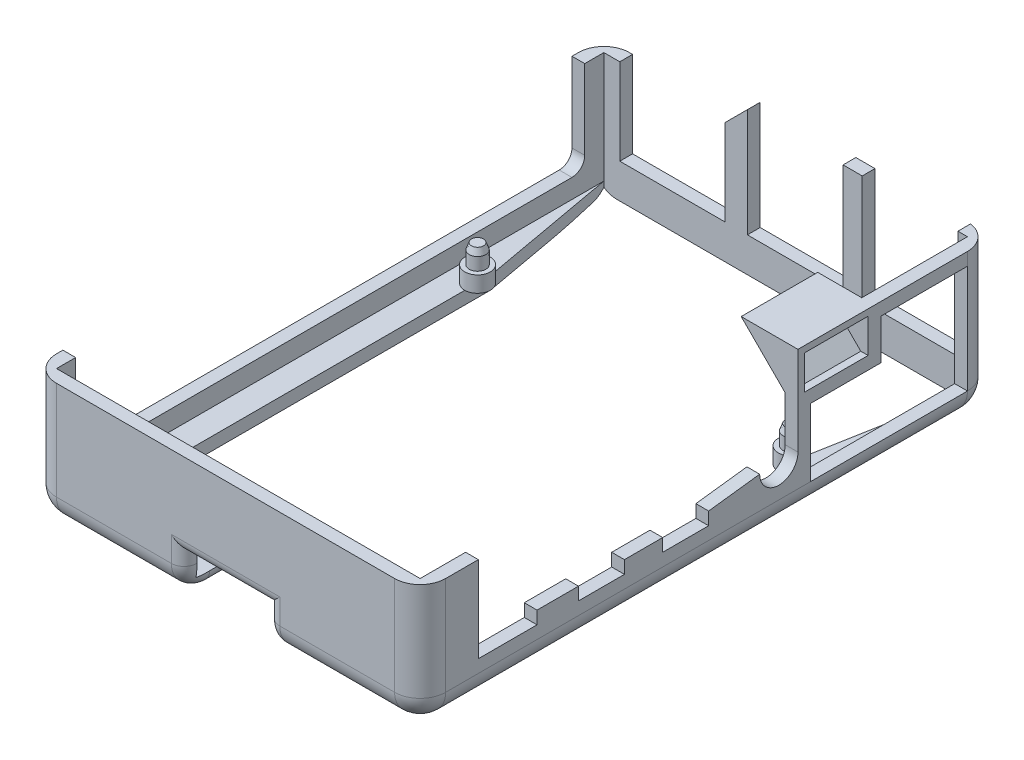
from build123d import *

# Parameters (mm, degrees)
SZKIC1_W                     = 56.2
SZKIC1_H                     = 85
DODANIE_WYCI_GNI_CIE2_DEPTH  = 2
SZKIC2_R                     = 2
DODANIE_WYCI_GNI_CIE5_DEPTH  = 2.5
SZKIC4_R                     = 1.3
DODANIE_WYCI_GNI_CIE6_DEPTH  = 2
SZKIC6_R                     = 1.3
DODANIE_WYCI_GNI_CIE7_DEPTH  = 1
DODANIE_WYCI_GNI_CIE7_TAPER  = 20
SZKIC1_4_W                   = 57
SZKIC1_4_H                   = 85.8
SZKIC1_4_W_2                 = 56.2
SZKIC1_4_H_2                 = 85
DODANIE_WYCI_GNI_CIE3_DEPTH  = 2
SZKIC1_5_W                   = 61
SZKIC1_5_H                   = 89.8
SZKIC1_5_W_2                 = 57
SZKIC1_5_H_2                 = 85.8
DODANIE_WYCI_GNI_CIE4_DEPTH  = 4.5
LUSTRO2_COPY_1_SKETCH_R      = 1.3
LUSTRO2_COPY_1_DEPTH         = 2
LUSTRO2_COPY_2_SKETCH_R      = 1.3
LUSTRO2_COPY_2_DEPTH         = 1
LUSTRO2_COPY_2_TAPER         = 20
SZKIC12_W                    = 13
SZKIC12_H                    = 4.5
WYTNIJ_WYCI_GNI_CIE4_DEPTH   = 10
DODANIE_WYCI_GNI_CIE8_DEPTH  = 1.45
SZKIC14_W                    = 61
SZKIC14_H                    = 89.8
SZKIC14_W_2                  = 57
SZKIC14_H_2                  = 85.8
DODANIE_WYCI_GNI_CIE9_DEPTH  = 17
SZKIC15_W                    = 16.5
SZKIC15_H                    = 17
SZKIC15_W_2                  = 15
WYTNIJ_WYCI_GNI_CIE5_DEPTH   = 2
SZKIC16_W                    = 9.2
SZKIC16_H                    = 10.95
SZKIC16_H_2                  = 2
SZKIC16_W_2                  = 7.2
SZKIC16_W_3                  = 8
SZKIC16_W_4                  = 6
SZKIC16_W_5                  = 6.5
WYTNIJ_WYCI_GNI_CIE6_DEPTH   = 2
ZAOKR_GLENIE1_R              = 4
ZAOKR_GLENIE2_R              = 2
DODANIE_WYCI_GNI_CIE10_DEPTH = 12
WYTNIJ_WYCI_GNI_CIE8_REACH   = 81.144
SZKIC19_W                    = 10
SZKIC19_H                    = 5.333929422
DODANIE_WYCI_GNI_CIE11_DEPTH = 10
WYTNIJ_WYCI_GNI_CIE9_REACH   = 60.932
WYTNIJ_WYCI_GNI_CIE10_DEPTH  = 2
SZKIC23_W                    = 87.8
SZKIC23_H                    = 3.5
WYTNIJ_WYCI_GNI_CIE11_DEPTH  = 2
SZKIC24_W                    = 59
SZKIC24_H                    = 3.5
WYTNIJ_WYCI_GNI_CIE12_DEPTH  = 2
SZKIC25_W                    = 7.125
SZKIC25_H                    = 3.5
WYTNIJ_WYCI_GNI_CIE13_DEPTH  = 2
WYTNIJ_WYCI_GNI_CIE14_DEPTH  = 2
WYTNIJ_WYCI_GNI_CIE16_DEPTH  = 2


with BuildPart() as part:
    # Szkic1 → Dodanie-wyciągnięcie2 (new body)
    with BuildSketch(Plane(origin=(0, 0, 0), x_dir=(1, 0, 0), z_dir=(0, 1, 0))):
        Rectangle(SZKIC1_W, SZKIC1_H)
    extrude(amount=DODANIE_WYCI_GNI_CIE2_DEPTH)

    # Szkic2 → Dodanie-wyciągnięcie5 (add)
    with BuildSketch(Plane(origin=(0, 2, 0), x_dir=(1, 0, 0), z_dir=(0, 1, 0))):
        with Locations(Location((-24.575, -38.975, 0), (0, 0, 270))):
            Circle(SZKIC2_R)
        with Locations(Location((24.575, -38.975, 0), (0, 0, 270))):
            Circle(SZKIC2_R)
        with Locations(Location((-24.575, 19.175, 0), (0, 0, 270))):
            Circle(SZKIC2_R)
        with Locations(Location((24.575, 19.175, 0), (0, 0, 270))):
            Circle(SZKIC2_R)
    extrude(amount=DODANIE_WYCI_GNI_CIE5_DEPTH)

    # Szkic4 → Dodanie-wyciągnięcie6 (add)
    with BuildSketch(Plane(origin=(0, 4.5, 0), x_dir=(1, 0, 0), z_dir=(0, 1, 0))):
        with Locations(Location((-24.575, 19.175, 0), (0, 0, 270))):
            Circle(SZKIC4_R)
    dodanie_wyci_gni_cie6 = extrude(amount=DODANIE_WYCI_GNI_CIE6_DEPTH)

    # Szkic6 → Dodanie-wyciągnięcie7 (add)
    with BuildSketch(Plane(origin=(0, 6.5, 0), x_dir=(1, 0, 0), z_dir=(0, 1, 0))):
        with Locations(Location((-24.575, 19.175, 0), (0, 0, 270))):
            Circle(SZKIC6_R)
    dodanie_wyci_gni_cie7 = extrude(amount=DODANIE_WYCI_GNI_CIE7_DEPTH, taper=DODANIE_WYCI_GNI_CIE7_TAPER)

    # Szkic1<4> → Dodanie-wyciągnięcie3 (add)
    with BuildSketch(Plane(origin=(0, 0, 0), x_dir=(1, 0, 0), z_dir=(0, 1, 0))):
        Rectangle(SZKIC1_4_W, SZKIC1_4_H)
        Rectangle(SZKIC1_4_W_2, SZKIC1_4_H_2, mode=Mode.SUBTRACT)
    extrude(amount=DODANIE_WYCI_GNI_CIE3_DEPTH)

    # Szkic1<5> → Dodanie-wyciągnięcie4 (add)
    with BuildSketch(Plane(origin=(0, 0, 0), x_dir=(1, 0, 0), z_dir=(0, 1, 0))):
        Rectangle(SZKIC1_5_W, SZKIC1_5_H)
        Rectangle(SZKIC1_5_W_2, SZKIC1_5_H_2, mode=Mode.SUBTRACT)
    extrude(amount=DODANIE_WYCI_GNI_CIE4_DEPTH)

    # Lustro1: Dodanie-wyciągnięcie6, Dodanie-wyciągnięcie7 across plane
    add(dodanie_wyci_gni_cie6.mirror(Plane(origin=(0, 0, 0), x_dir=(0, 0, 1), z_dir=(1, 0, 0))))
    add(dodanie_wyci_gni_cie7.mirror(Plane(origin=(0, 0, 0), x_dir=(0, 0, 1), z_dir=(1, 0, 0))))

    # Lustro2: Dodanie-wyciągnięcie6, Dodanie-wyciągnięcie7 across plane
    add(dodanie_wyci_gni_cie6.mirror(Plane.XY.offset(9.9)))
    add(dodanie_wyci_gni_cie7.mirror(Plane.XY.offset(9.9)))

    # Lustro2 copy 1 sketch → Lustro2 copy 1 (add)
    with BuildSketch(Plane(origin=(0, 4.5, 19.8), x_dir=(-1, 0, 0), z_dir=(0, 1, 0))):
        with Locations(Location((-24.575, 19.175, 0), (0, 0, 270))):
            Circle(LUSTRO2_COPY_1_SKETCH_R)
    extrude(amount=LUSTRO2_COPY_1_DEPTH)

    # Lustro2 copy 2 sketch → Lustro2 copy 2 (add)
    with BuildSketch(Plane(origin=(0, 6.5, 19.8), x_dir=(-1, 0, 0), z_dir=(0, 1, 0))):
        with Locations(Location((-24.575, 19.175, 0), (0, 0, 270))):
            Circle(LUSTRO2_COPY_2_SKETCH_R)
    extrude(amount=LUSTRO2_COPY_2_DEPTH, taper=LUSTRO2_COPY_2_TAPER)

    # Szkic12 → Wytnij-wyciągnięcie4 (cut)
    with BuildSketch(Plane.XY.offset(44.9)):
        with Locations((0, 2.25)):
            Rectangle(SZKIC12_W, SZKIC12_H)
    extrude(amount=-WYTNIJ_WYCI_GNI_CIE4_DEPTH, mode=Mode.SUBTRACT)

    # Szkic13 → Dodanie-wyciągnięcie8 (add)
    with BuildSketch(Plane(origin=(0, 4.5, 0), x_dir=(1, 0, 0), z_dir=(0, 1, 0))):
        Polygon((-6.5, -44.9), (-6.5, -42.9), (-28.5, -42.9), (-28.5, 42.9), (28.5, 42.9), (28.5, -42.9), (6.5, -42.9), (6.5, -44.9), (30.5, -44.9), (30.5, 44.9), (-30.5, 44.9), (-30.5, -44.9), align=None)
    extrude(amount=DODANIE_WYCI_GNI_CIE8_DEPTH)

    # Szkic14 → Dodanie-wyciągnięcie9 (add)
    with BuildSketch(Plane(origin=(0, 5.95, 0), x_dir=(1, 0, 0), z_dir=(0, 1, 0))):
        Rectangle(SZKIC14_W, SZKIC14_H)
        Rectangle(SZKIC14_W_2, SZKIC14_H_2, mode=Mode.SUBTRACT)
    extrude(amount=DODANIE_WYCI_GNI_CIE9_DEPTH)

    # Szkic15 → Wytnij-wyciągnięcie5 (cut)
    with BuildSketch(Plane(origin=(0, 0, -44.9), x_dir=(-1, 0, 0), z_dir=(0, 0, -1))):
        with Locations((17.75, 14.45)):
            Rectangle(SZKIC15_W, SZKIC15_H)
        with Locations((-1.5, 14.45)):
            Rectangle(SZKIC15_W_2, SZKIC15_H)
        with Locations((-19.5, 14.45)):
            Rectangle(SZKIC15_W_2, SZKIC15_H)
    extrude(amount=-WYTNIJ_WYCI_GNI_CIE5_DEPTH, mode=Mode.SUBTRACT)

    # Szkic16 → Wytnij-wyciągnięcie6 (cut)
    with BuildSketch(Plane(origin=(30.5, 0, 0), x_dir=(0, 0, -1), z_dir=(1, 0, 0))):
        with Locations((-31.175, 17.475)):
            Rectangle(SZKIC16_W, SZKIC16_H)
        with Locations((-31.175, 11)):
            Rectangle(SZKIC16_W, SZKIC16_H_2)
        with Locations((-31.175, 9)):
            Rectangle(SZKIC16_W, SZKIC16_H_2)
        with Locations((-31.175, 7)):
            Rectangle(SZKIC16_W, SZKIC16_H_2)
        with Locations((-16.475, 17.475)):
            Rectangle(SZKIC16_W_2, SZKIC16_H)
        with Locations((-16.475, 11)):
            Rectangle(SZKIC16_W_2, SZKIC16_H_2)
        with Locations((-16.475, 9)):
            Rectangle(SZKIC16_W_2, SZKIC16_H_2)
        with Locations((-16.475, 7)):
            Rectangle(SZKIC16_W_2, SZKIC16_H_2)
        with Locations((-3.275, 17.475)):
            Rectangle(SZKIC16_W_2, SZKIC16_H)
        with Locations((-3.275, 11)):
            Rectangle(SZKIC16_W_2, SZKIC16_H_2)
        with Locations((-3.275, 9)):
            Rectangle(SZKIC16_W_2, SZKIC16_H_2)
        with Locations((-3.275, 7)):
            Rectangle(SZKIC16_W_2, SZKIC16_H_2)
        with Locations((4.325, 17.475)):
            Rectangle(SZKIC16_W_3, SZKIC16_H)
        with Locations((4.325, 11)):
            Rectangle(SZKIC16_W_3, SZKIC16_H_2)
        Polygon((8.325, 10), (0.325, 10), (0.325, 8), (8.325, 9), align=None)
        with Locations((-9.875, 17.475)):
            Rectangle(SZKIC16_W_4, SZKIC16_H)
        with Locations((-9.875, 11)):
            Rectangle(SZKIC16_W_4, SZKIC16_H_2)
        with Locations((-9.875, 9)):
            Rectangle(SZKIC16_W_4, SZKIC16_H_2)
        with Locations((-23.325, 17.475)):
            Rectangle(SZKIC16_W_5, SZKIC16_H)
        with Locations((-23.325, 11)):
            Rectangle(SZKIC16_W_5, SZKIC16_H_2)
        with Locations((-23.325, 9)):
            Rectangle(SZKIC16_W_5, SZKIC16_H_2)
        with BuildLine():
            ThreePointArc((8.496572875, 10), (8.368204321, 9.507305936), (8.325, 9))
            ThreePointArc((8.325, 9), (8.368204321, 8.492694064), (8.496572875, 8))
            Line((8.496572875, 8), (14.153427125, 8))
            ThreePointArc((14.153427125, 8), (14.281795679, 8.492694064), (14.325, 9))
            ThreePointArc((14.325, 9), (14.281795679, 9.507305936), (14.153427125, 10))
            Line((14.153427125, 10), (8.496572875, 10))
        make_face()
        with BuildLine():
            ThreePointArc((14.153427125, 10), (13.057050808, 11.449489743), (11.325, 12))
            ThreePointArc((11.325, 12), (9.592949192, 11.449489743), (8.496572875, 10))
            Line((8.496572875, 10), (14.153427125, 10))
        make_face()
        with BuildLine():
            Line((14.153427125, 8), (8.496572875, 8))
            ThreePointArc((8.496572875, 8), (9.592949189, 6.55051026), (11.324999991, 6))
            ThreePointArc((11.324999991, 6), (13.057050804, 6.550510255), (14.153427125, 8))
        make_face()
        with BuildLine():
            Line((11.325, 12), (8.325, 12))
            Line((8.325, 12), (8.325, 10))
            Line((8.325, 10), (8.496572875, 10))
            ThreePointArc((8.496572875, 10), (9.592949192, 11.449489743), (11.325, 12))
        make_face()
        with BuildLine():
            Line((14.325, 10), (14.325, 12))
            Line((14.325, 12), (11.325, 12))
            ThreePointArc((11.325, 12), (13.057050808, 11.449489743), (14.153427125, 10))
            Line((14.153427125, 10), (14.325, 10))
        make_face()
        Polygon((14.325, 22.95), (8.325, 22.95), (8.325, 12), (11.325, 12), (14.325, 12), align=None)
        with BuildLine():
            Line((14.325, 9), (14.325, 10))
            Line((14.325, 10), (14.153427125, 10))
            ThreePointArc((14.153427125, 10), (14.281795679, 9.507305936), (14.325, 9))
        make_face()
        with BuildLine():
            Line((8.496572875, 10), (8.325, 10))
            Line((8.325, 10), (8.325, 9))
            ThreePointArc((8.325, 9), (8.368204321, 9.507305936), (8.496572875, 10))
        make_face()
    extrude(amount=-WYTNIJ_WYCI_GNI_CIE6_DEPTH, mode=Mode.SUBTRACT)

    # Zaokrąglenie1
    zaokr_glenie1_edges = [part.edges().sort_by_distance(p)[0] for p in [
        (-18.5, 0, 44.9),
        (18.5, 0, 44.9),
        (30.5, 0, 0),
        (-30.5, 0, 0),
        (0, 0, -44.9),
        (-30.5, 11.475, -44.9),
        (30.5, 11.475, -44.9),
        (30.5, 11.475, 44.9),
        (-30.5, 11.475, 44.9),
    ]]
    fillet(zaokr_glenie1_edges, radius=ZAOKR_GLENIE1_R)

    # Zaokrąglenie2
    # the kernel refuses this fillet: 2 mm, written as the material it takes off along each edge
    with BuildSketch(Plane(origin=(6.5, 5.95, 44.9), x_dir=(0, 0, -1), z_dir=(0, -1, 0))) as zaokr_glenie2_piece_1:
        with BuildLine():
            CenterArc((ZAOKR_GLENIE2_R, ZAOKR_GLENIE2_R), ZAOKR_GLENIE2_R, 180, 90)
            Line((0, ZAOKR_GLENIE2_R), (0, 0))
            Line((0, 0), (ZAOKR_GLENIE2_R, 0))
        make_face()
    extrude(amount=1.95, mode=Mode.SUBTRACT)
    with BuildSketch(Plane(origin=(-6.5, 5.95, 44.9), x_dir=(0, 0, -1), z_dir=(0, -1, 0))) as zaokr_glenie2_piece_2:
        with BuildLine():
            CenterArc((ZAOKR_GLENIE2_R, -ZAOKR_GLENIE2_R), ZAOKR_GLENIE2_R, 90, 90)
            Line((0, -ZAOKR_GLENIE2_R), (0, 0))
            Line((0, 0), (ZAOKR_GLENIE2_R, 0))
        make_face()
    extrude(amount=1.95, mode=Mode.SUBTRACT)
    with BuildSketch(Plane(origin=(-6.5, 0, 40.9), x_dir=(-1, 0, 0), z_dir=(0, 0, -1))) as zaokr_glenie2_piece_3:
        with BuildLine():
            CenterArc((ZAOKR_GLENIE2_R, ZAOKR_GLENIE2_R), ZAOKR_GLENIE2_R, 180, 90)
            Line((0, ZAOKR_GLENIE2_R), (0, 0))
            Line((0, 0), (ZAOKR_GLENIE2_R, 0))
        make_face()
    extrude(amount=6, mode=Mode.SUBTRACT)
    with BuildSketch(Plane(origin=(-6.5, 5.95, 44.9), x_dir=(0, 1, 0), z_dir=(1, 0, 0))) as zaokr_glenie2_piece_4:
        with BuildLine():
            CenterArc((ZAOKR_GLENIE2_R, -ZAOKR_GLENIE2_R), ZAOKR_GLENIE2_R, 90, 90)
            Line((0, -ZAOKR_GLENIE2_R), (0, 0))
            Line((0, 0), (ZAOKR_GLENIE2_R, 0))
        make_face()
    extrude(amount=13, mode=Mode.SUBTRACT)
    with BuildSketch(Plane(origin=(6.5, 0, 40.9), x_dir=(1, 0, 0), z_dir=(0, 0, -1))) as zaokr_glenie2_piece_5:
        with BuildLine():
            CenterArc((ZAOKR_GLENIE2_R, -ZAOKR_GLENIE2_R), ZAOKR_GLENIE2_R, 90, 90)
            Line((0, -ZAOKR_GLENIE2_R), (0, 0))
            Line((0, 0), (ZAOKR_GLENIE2_R, 0))
        make_face()
    extrude(amount=6, mode=Mode.SUBTRACT)
    with BuildSketch(Plane(origin=(6.5, 4, 40.9), x_dir=(0, -1, 0), z_dir=(0, 0, -1))) as zaokr_glenie2_piece_6:
        with BuildLine():
            CenterArc((4 - ZAOKR_GLENIE2_R, -ZAOKR_GLENIE2_R), ZAOKR_GLENIE2_R, 0, 90)
            Line((4, -ZAOKR_GLENIE2_R), (4, 0))
            Line((4, 0), (4 - ZAOKR_GLENIE2_R, 0))
        make_face()
    revolve(axis=Axis((6.5, 4, 40.9), (-1, 0, 0)), revolution_arc=90, mode=Mode.SUBTRACT)
    with BuildSketch(Plane(origin=(-6.5, 4, 40.9), x_dir=(0, -1, 0), z_dir=(0, 0, -1))) as zaokr_glenie2_piece_7:
        with BuildLine():
            CenterArc((4 - ZAOKR_GLENIE2_R, ZAOKR_GLENIE2_R), ZAOKR_GLENIE2_R, 270, 90)
            Line((4, ZAOKR_GLENIE2_R), (4, 0))
            Line((4, 0), (4 - ZAOKR_GLENIE2_R, 0))
        make_face()
    revolve(axis=Axis((-6.5, 4, 40.9), (-1, 0, 0)), revolution_arc=90, mode=Mode.SUBTRACT)
    with BuildSketch(Plane(origin=(-6.5, 0, 34.9), x_dir=(0, 0, -1), z_dir=(1, 0, 0))) as zaokr_glenie2_piece_8:
        with BuildLine():
            CenterArc((ZAOKR_GLENIE2_R, ZAOKR_GLENIE2_R), ZAOKR_GLENIE2_R, 180, 90)
            Line((0, ZAOKR_GLENIE2_R), (0, 0))
            Line((0, 0), (ZAOKR_GLENIE2_R, 0))
        make_face()
    extrude(amount=13, mode=Mode.SUBTRACT)
    with BuildSketch(Plane(origin=(6.5, 10.95, 44.9), x_dir=(0, 0, -1), z_dir=(0, -1, 0))) as zaokr_glenie2_piece_9a_section:
        with BuildLine():
            CenterArc((ZAOKR_GLENIE2_R, ZAOKR_GLENIE2_R), ZAOKR_GLENIE2_R, 180, 90)
            Line((0, ZAOKR_GLENIE2_R), (0, 0))
            Line((0, 0), (ZAOKR_GLENIE2_R, 0))
        make_face()
    zaokr_glenie2_piece_9a = extrude(amount=6.95, mode=Mode.PRIVATE)
    zaokr_glenie2_piece_9a = split(zaokr_glenie2_piece_9a, bisect_by=Plane(origin=(6.952790229, 5.95, 44.447209771), z_dir=(0, 1, 0)), keep=Keep.TOP, mode=Mode.PRIVATE)
    with BuildSketch(Plane(origin=(-6.5, 5.95, 44.9), x_dir=(0, 1, 0), z_dir=(1, 0, 0))) as zaokr_glenie2_piece_9b_section:
        with BuildLine():
            CenterArc((ZAOKR_GLENIE2_R, -ZAOKR_GLENIE2_R), ZAOKR_GLENIE2_R, 90, 90)
            Line((0, -ZAOKR_GLENIE2_R), (0, 0))
            Line((0, 0), (ZAOKR_GLENIE2_R, 0))
        make_face()
    zaokr_glenie2_piece_9b = extrude(amount=18, mode=Mode.PRIVATE)
    zaokr_glenie2_piece_9b = split(zaokr_glenie2_piece_9b, bisect_by=Plane(origin=(6.5, 6.402790229, 44.447209771), z_dir=(1, 0, 0)), keep=Keep.TOP, mode=Mode.PRIVATE)
    zaokr_glenie2_piece_9 = zaokr_glenie2_piece_9a & zaokr_glenie2_piece_9b
    add(zaokr_glenie2_piece_9, mode=Mode.SUBTRACT)
    with BuildSketch(Plane(origin=(-6.5, 10.95, 44.9), x_dir=(0, 0, -1), z_dir=(0, -1, 0))) as zaokr_glenie2_piece_10a_section:
        with BuildLine():
            CenterArc((ZAOKR_GLENIE2_R, -ZAOKR_GLENIE2_R), ZAOKR_GLENIE2_R, 90, 90)
            Line((0, -ZAOKR_GLENIE2_R), (0, 0))
            Line((0, 0), (ZAOKR_GLENIE2_R, 0))
        make_face()
    zaokr_glenie2_piece_10a = extrude(amount=6.95, mode=Mode.PRIVATE)
    zaokr_glenie2_piece_10a = split(zaokr_glenie2_piece_10a, bisect_by=Plane(origin=(-6.952790229, 5.95, 44.447209771), z_dir=(0, 1, 0)), keep=Keep.TOP, mode=Mode.PRIVATE)
    with BuildSketch(Plane(origin=(-11.5, 5.95, 44.9), x_dir=(0, 1, 0), z_dir=(1, 0, 0))) as zaokr_glenie2_piece_10b_section:
        with BuildLine():
            CenterArc((ZAOKR_GLENIE2_R, -ZAOKR_GLENIE2_R), ZAOKR_GLENIE2_R, 90, 90)
            Line((0, -ZAOKR_GLENIE2_R), (0, 0))
            Line((0, 0), (ZAOKR_GLENIE2_R, 0))
        make_face()
    zaokr_glenie2_piece_10b = extrude(amount=18, mode=Mode.PRIVATE)
    zaokr_glenie2_piece_10b = split(zaokr_glenie2_piece_10b, bisect_by=Plane(origin=(-6.5, 6.402790229, 44.447209771), z_dir=(-1, 0, 0)), keep=Keep.TOP, mode=Mode.PRIVATE)
    zaokr_glenie2_piece_10 = zaokr_glenie2_piece_10a & zaokr_glenie2_piece_10b
    add(zaokr_glenie2_piece_10, mode=Mode.SUBTRACT)
    with BuildSketch(Plane(origin=(-11.5, 0, 34.9), x_dir=(0, 0, -1), z_dir=(1, 0, 0))) as zaokr_glenie2_piece_11a_section:
        with BuildLine():
            CenterArc((ZAOKR_GLENIE2_R, ZAOKR_GLENIE2_R), ZAOKR_GLENIE2_R, 180, 90)
            Line((0, ZAOKR_GLENIE2_R), (0, 0))
            Line((0, 0), (ZAOKR_GLENIE2_R, 0))
        make_face()
    zaokr_glenie2_piece_11a = extrude(amount=18, mode=Mode.PRIVATE)
    zaokr_glenie2_piece_11a = split(zaokr_glenie2_piece_11a, bisect_by=Plane(origin=(-6.5, 0.452790229, 34.447209771), z_dir=(-1, 0, 0)), keep=Keep.TOP, mode=Mode.PRIVATE)
    with BuildSketch(Plane(origin=(-6.5, 0, 40.9), x_dir=(-1, 0, 0), z_dir=(0, 0, -1))) as zaokr_glenie2_piece_11b_section:
        with BuildLine():
            CenterArc((ZAOKR_GLENIE2_R, ZAOKR_GLENIE2_R), ZAOKR_GLENIE2_R, 180, 90)
            Line((0, ZAOKR_GLENIE2_R), (0, 0))
            Line((0, 0), (ZAOKR_GLENIE2_R, 0))
        make_face()
    zaokr_glenie2_piece_11b = extrude(amount=11, mode=Mode.PRIVATE)
    zaokr_glenie2_piece_11b = split(zaokr_glenie2_piece_11b, bisect_by=Plane(origin=(-6.952790229, 0.452790229, 34.9), z_dir=(0, 0, -1)), keep=Keep.TOP, mode=Mode.PRIVATE)
    zaokr_glenie2_piece_11 = zaokr_glenie2_piece_11a & zaokr_glenie2_piece_11b
    add(zaokr_glenie2_piece_11, mode=Mode.SUBTRACT)
    with BuildSketch(Plane(origin=(6.5, 0, 40.9), x_dir=(1, 0, 0), z_dir=(0, 0, -1))) as zaokr_glenie2_piece_12a_section:
        with BuildLine():
            CenterArc((ZAOKR_GLENIE2_R, -ZAOKR_GLENIE2_R), ZAOKR_GLENIE2_R, 90, 90)
            Line((0, -ZAOKR_GLENIE2_R), (0, 0))
            Line((0, 0), (ZAOKR_GLENIE2_R, 0))
        make_face()
    zaokr_glenie2_piece_12a = extrude(amount=11, mode=Mode.PRIVATE)
    zaokr_glenie2_piece_12a = split(zaokr_glenie2_piece_12a, bisect_by=Plane(origin=(6.952790229, 0.452790229, 34.9), z_dir=(0, 0, -1)), keep=Keep.TOP, mode=Mode.PRIVATE)
    with BuildSketch(Plane(origin=(-6.5, 0, 34.9), x_dir=(0, 0, -1), z_dir=(1, 0, 0))) as zaokr_glenie2_piece_12b_section:
        with BuildLine():
            CenterArc((ZAOKR_GLENIE2_R, ZAOKR_GLENIE2_R), ZAOKR_GLENIE2_R, 180, 90)
            Line((0, ZAOKR_GLENIE2_R), (0, 0))
            Line((0, 0), (ZAOKR_GLENIE2_R, 0))
        make_face()
    zaokr_glenie2_piece_12b = extrude(amount=18, mode=Mode.PRIVATE)
    zaokr_glenie2_piece_12b = split(zaokr_glenie2_piece_12b, bisect_by=Plane(origin=(6.5, 0.452790229, 34.447209771), z_dir=(1, 0, 0)), keep=Keep.TOP, mode=Mode.PRIVATE)
    zaokr_glenie2_piece_12 = zaokr_glenie2_piece_12a & zaokr_glenie2_piece_12b
    add(zaokr_glenie2_piece_12, mode=Mode.SUBTRACT)

    # Szkic18 → Dodanie-wyciągnięcie10 (add)
    with BuildSketch(Plane.XY.offset(-14.325)):
        Polygon((28.5, 22.95), (21.6, 22.95), (28.5, 16.05), align=None)
    extrude(amount=-DODANIE_WYCI_GNI_CIE10_DEPTH)

    # Wytnij-wyciągnięcie8: up to this plane
    wytnij_wyci_gni_cie8_end = Plane(origin=(21.6, 22.95, -26.325), z_dir=(-0.7071067811865515, -0.7071067811865436, 0))
    # Szkic19 → Wytnij-wyciągnięcie8 (cut, up to the surface)
    with BuildSketch(Plane(origin=(30.5, 0, 0), x_dir=(0, 0, -1), z_dir=(1, 0, 0)), mode=Mode.PRIVATE) as wytnij_wyci_gni_cie8_sk1:
        with Locations((20.325, 19.283035289)):
            Rectangle(SZKIC19_W, SZKIC19_H)
    wytnij_wyci_gni_cie8_tool1 = split(extrude(wytnij_wyci_gni_cie8_sk1.sketch, amount=-WYTNIJ_WYCI_GNI_CIE8_REACH, mode=Mode.PRIVATE), bisect_by=wytnij_wyci_gni_cie8_end, keep=Keep.BOTH, mode=Mode.PRIVATE)
    add(wytnij_wyci_gni_cie8_tool1.solids().sort_by_distance((30.5, 19.283035, -20.325))[0], mode=Mode.SUBTRACT)

    # Szkic20 → Dodanie-wyciągnięcie11 (add)
    with BuildSketch(Plane.XY.offset(-25.325)):
        Polygon((28.641036203, 17.323177359), (24.014213562, 21.95), (22.6, 21.95), (27.933929422, 16.616070578), (29.348142984, 16.616070578), align=None)
    extrude(amount=DODANIE_WYCI_GNI_CIE11_DEPTH)

    # Wytnij-wyciągnięcie9: up to this face of the body (flat: up to its plane)
    wytnij_wyci_gni_cie9_end = Plane(part.part.faces().sort_by_distance((0, 2, -0.960651839))[0])
    # Szkic21 → Wytnij-wyciągnięcie9 (cut, up to the picked face)
    with BuildSketch(Plane(origin=(0, 0, 0), x_dir=(-1, 0, 0), z_dir=(0, -1, 0)), mode=Mode.PRIVATE) as wytnij_wyci_gni_cie9_sk1:
        with BuildLine():
            Line((9.5, -36.975), (24.575, -36.975))
            Line((24.575, -36.975), (24.575, 21.175))
            Line((24.575, 21.175), (26.5, 31.829936306))
            Line((26.5, 31.829936306), (26.5, 40.9))
            Line((26.5, 40.9), (-26.5, 40.9))
            Line((-26.5, 40.9), (-26.5, 31.829936306))
            Line((-26.5, 31.829936306), (-24.575, 21.175))
            Line((-24.575, 21.175), (-24.575, -36.975))
            Line((-24.575, -36.975), (-9.5, -36.975))
            Line((-9.5, -36.975), (-9.5, -32.9))
            ThreePointArc((-9.5, -32.9), (-9.207106781, -32.192893219), (-8.5, -31.9))
            Line((-8.5, -31.9), (8.5, -31.9))
            ThreePointArc((8.5, -31.9), (9.207106781, -32.192893219), (9.5, -32.9))
            Line((9.5, -32.9), (9.5, -36.975))
        make_face()
    wytnij_wyci_gni_cie9_tool1 = split(extrude(wytnij_wyci_gni_cie9_sk1.sketch, amount=-WYTNIJ_WYCI_GNI_CIE9_REACH, mode=Mode.PRIVATE), bisect_by=wytnij_wyci_gni_cie9_end, keep=Keep.BOTH, mode=Mode.PRIVATE)
    # Szkic21 → Wytnij-wyciągnięcie9 (cut, up to the picked face)
    with BuildSketch(Plane(origin=(0, 0, 0), x_dir=(-1, 0, 0), z_dir=(0, -1, 0)), mode=Mode.PRIVATE) as wytnij_wyci_gni_cie9_sk2:
        Polygon((26.5, 40.9), (26.5, 31.829936306), (28.5, 42.9), (-28.5, 42.9), (-26.5, 31.829936306), (-26.5, 40.9), align=None)
    wytnij_wyci_gni_cie9_tool2 = split(extrude(wytnij_wyci_gni_cie9_sk2.sketch, amount=-WYTNIJ_WYCI_GNI_CIE9_REACH, mode=Mode.PRIVATE), bisect_by=wytnij_wyci_gni_cie9_end, keep=Keep.BOTH, mode=Mode.PRIVATE)
    add(wytnij_wyci_gni_cie9_tool1.solids().sort_by(Axis((0, 0, -3.345213), (0, 1, 0)))[0], mode=Mode.SUBTRACT)
    add(wytnij_wyci_gni_cie9_tool2.solids().sort_by(Axis((0, 0, -41.435217), (0, 1, 0)))[0], mode=Mode.SUBTRACT)

    # Szkic22 → Wytnij-wyciągnięcie10 (cut)
    with BuildSketch(Plane(origin=(0, 0, -44.9), x_dir=(-1, 0, 0), z_dir=(0, 0, -1))):
        Polygon((6, 22.95), (9.5, 19.45), (9.5, 22.95), align=None)
        Polygon((25.96894209, 19.45), (30.5, 19.45), (30.5, 22.95), (26, 22.95), align=None)
    extrude(amount=-WYTNIJ_WYCI_GNI_CIE10_DEPTH, mode=Mode.SUBTRACT)

    # Szkic23 → Wytnij-wyciągnięcie11 (cut)
    with BuildSketch(Plane.ZY.offset(30.5)):
        with Locations((1, 21.2)):
            Rectangle(SZKIC23_W, SZKIC23_H)
    extrude(amount=-WYTNIJ_WYCI_GNI_CIE11_DEPTH, mode=Mode.SUBTRACT)

    # Szkic24 → Wytnij-wyciągnięcie12 (cut)
    with BuildSketch(Plane.XY.offset(44.9)):
        with Locations((1, 21.2)):
            Rectangle(SZKIC24_W, SZKIC24_H)
    extrude(amount=-WYTNIJ_WYCI_GNI_CIE12_DEPTH, mode=Mode.SUBTRACT)

    # Szkic25 → Wytnij-wyciągnięcie13 (cut)
    with BuildSketch(Plane(origin=(30.5, 0, 0), x_dir=(0, 0, -1), z_dir=(1, 0, 0))):
        with Locations((-39.3375, 21.2)):
            Rectangle(SZKIC25_W, SZKIC25_H)
    extrude(amount=-WYTNIJ_WYCI_GNI_CIE13_DEPTH, mode=Mode.SUBTRACT)

    # Szkic26 → Wytnij-wyciągnięcie14 (cut)
    with BuildSketch(Plane.ZY.offset(30.5)):
        with BuildLine():
            Line((-39.9, 19.45), (-39.9, 7))
            ThreePointArc((-39.9, 7), (-39.314213562, 5.585786438), (-37.9, 5))
            Line((-37.9, 5), (37.9, 5))
            ThreePointArc((37.9, 5), (39.314213562, 5.585786438), (39.9, 7))
            Line((39.9, 7), (39.9, 19.45))
            Line((39.9, 19.45), (-39.9, 19.45))
        make_face()
    extrude(amount=-WYTNIJ_WYCI_GNI_CIE14_DEPTH, mode=Mode.SUBTRACT)

    # Szkic27 → Wytnij-wyciągnięcie16 (cut)
    with BuildSketch(Plane(origin=(30.5, 0, 0), x_dir=(0, 0, -1), z_dir=(1, 0, 0))):
        Polygon((16.325, 14.616070578), (27.325, 14.616070578), (27.325, 20.95), (40.9, 20.95), (40.9, 4), (16.325, 4), align=None)
    extrude(amount=-WYTNIJ_WYCI_GNI_CIE16_DEPTH, mode=Mode.SUBTRACT)


solid = part.part
